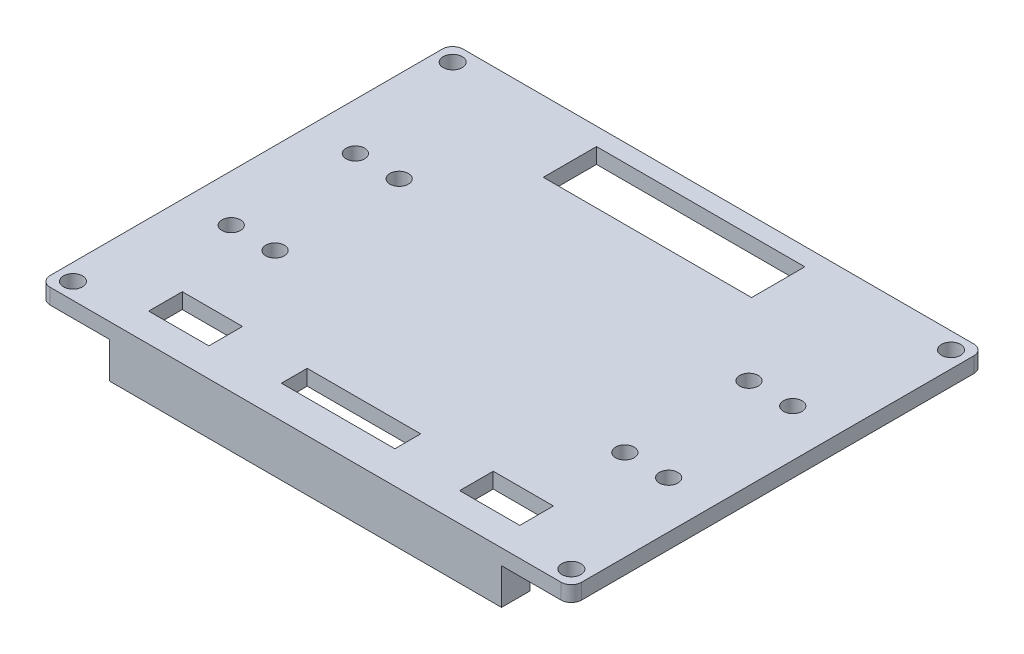
from build123d import *

# Parameters (mm, degrees)
SKETCH_1_R      = 1.85
SKETCH_1_W      = 11.667697598
SKETCH_1_H      = 6.517356375
SKETCH_1_R_2    = 1.8
SKETCH_1_W_2    = 22
SKETCH_1_H_2    = 5
SKETCH_1_W_3    = 40.374860346
SKETCH_1_H_3    = 10.321291022
EXTRUDE_1_DEPTH = 3
SKETCH_2_W      = 75.93825213
SKETCH_2_H      = 5.545458332
EXTRUDE_2_DEPTH = 10


with BuildPart() as part:
    # 草图1 → 凸台-拉伸1 (new body)
    with BuildSketch(Plane(origin=(0, 0, 0), x_dir=(1, 0, 0), z_dir=(0, 1, 0))):
        with BuildLine():
            Line((-49.5, -40), (49.5, -40))
            ThreePointArc((49.5, -40), (50.914213562, -39.414213562), (51.5, -38))
            Line((51.5, -38), (51.5, 38))
            ThreePointArc((51.5, 38), (50.914213562, 39.414213562), (49.5, 40))
            Line((49.5, 40), (-49.5, 40))
            ThreePointArc((-49.5, 40), (-50.914213562, 39.414213562), (-51.5, 38))
            Line((-51.5, 38), (-51.5, -38))
            ThreePointArc((-51.5, -38), (-50.914213562, -39.414213562), (-49.5, -40))
        make_face()
        with Locations((-48.296806281, -36.796806281)):
            Circle(SKETCH_1_R, mode=Mode.SUBTRACT)
        with Locations((-30.135277266, -31.195863481)):
            Rectangle(SKETCH_1_W, SKETCH_1_H, mode=Mode.SUBTRACT)
        with Locations((-42.391806281, -12.03)):
            Circle(SKETCH_1_R_2, mode=Mode.SUBTRACT)
        with Locations((-33.901806281, -12.03)):
            Circle(SKETCH_1_R_2, mode=Mode.SUBTRACT)
        with Locations((0, -31.19586348)):
            Rectangle(SKETCH_1_W_2, SKETCH_1_H_2, mode=Mode.SUBTRACT)
        with Locations((30.135277266, -31.195863481)):
            Rectangle(SKETCH_1_W, SKETCH_1_H, mode=Mode.SUBTRACT)
        with Locations((48.296806281, -36.796806281)):
            Circle(SKETCH_1_R, mode=Mode.SUBTRACT)
        with Locations((33.901806281, -12.03)):
            Circle(SKETCH_1_R_2, mode=Mode.SUBTRACT)
        with Locations((42.391806281, -12.03)):
            Circle(SKETCH_1_R_2, mode=Mode.SUBTRACT)
        with Locations((-42.391806281, 12.03)):
            Circle(SKETCH_1_R_2, mode=Mode.SUBTRACT)
        with Locations((-33.901806281, 12.03)):
            Circle(SKETCH_1_R_2, mode=Mode.SUBTRACT)
        with Locations((-48.296806281, 36.796806281)):
            Circle(SKETCH_1_R, mode=Mode.SUBTRACT)
        with Locations((33.901806281, 12.03)):
            Circle(SKETCH_1_R_2, mode=Mode.SUBTRACT)
        with Locations((42.391806281, 12.03)):
            Circle(SKETCH_1_R_2, mode=Mode.SUBTRACT)
        with Locations((0, 31.409786363)):
            Rectangle(SKETCH_1_W_3, SKETCH_1_H_3, mode=Mode.SUBTRACT)
        with Locations((48.296806281, 36.796806281)):
            Circle(SKETCH_1_R, mode=Mode.SUBTRACT)
    extrude(amount=EXTRUDE_1_DEPTH)

    # 草图2 → 凸台-拉伸2 (add)
    with BuildSketch(Plane(origin=(0, 3, 0), x_dir=(1, 0, 0), z_dir=(0, 1, 0))):
        with Locations((0, -37.227270834)):
            Rectangle(SKETCH_2_W, SKETCH_2_H)
    extrude(amount=-EXTRUDE_2_DEPTH)


solid = part.part
